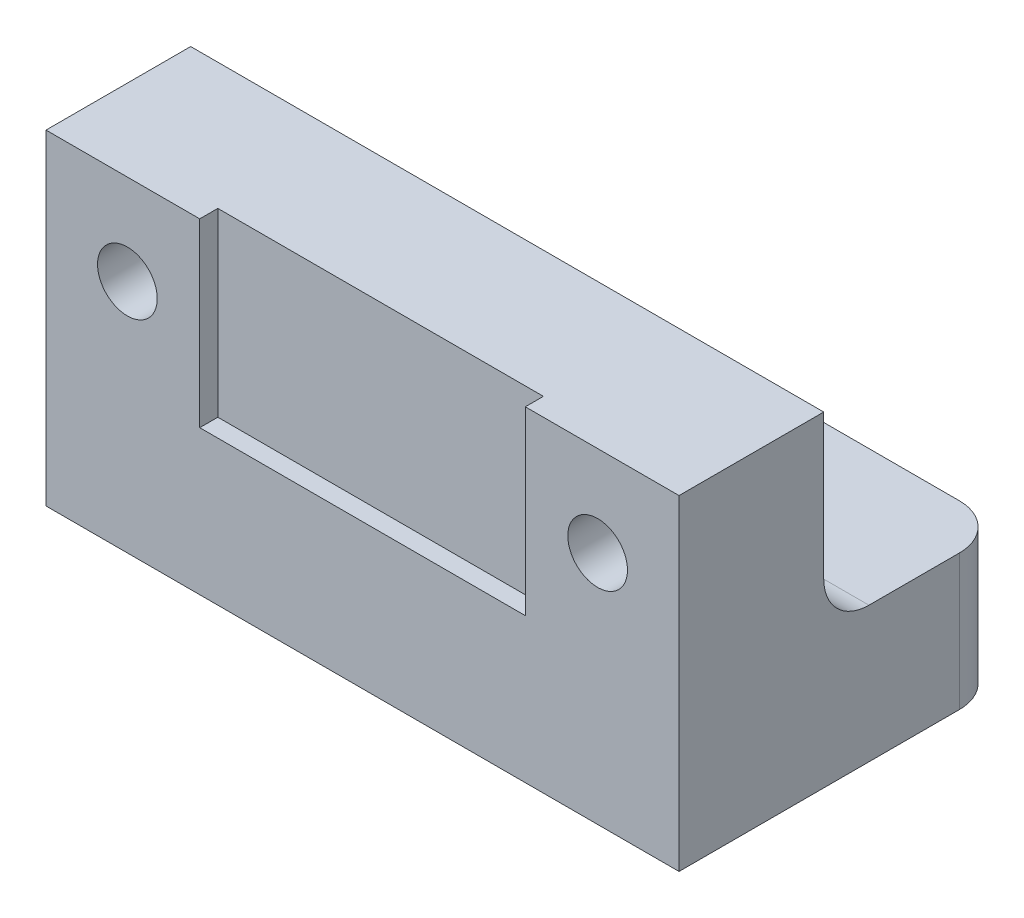
from build123d import *

# Parameters (mm, degrees)
SKETCH1_W           = 35
SKETCH1_H           = 18
BOSS_EXTRUDE1_DEPTH = 8
SKETCH4_W           = 18
SKETCH4_H           = 10
CUT_EXTRUDE3_DEPTH  = 1
CUT_EXTRUDE2_REACH  = 23.243
SKETCH3_R           = 1.65
SKETCH5_R           = 3
CUT_EXTRUDE4_DEPTH  = 4
SKETCH6_W           = 35
SKETCH6_H           = 7.5
BOSS_EXTRUDE2_DEPTH = 10
SKETCH7_R           = 8
CUT_EXTRUDE5_DEPTH  = 4.8
FILLET1_R           = 2.5


with BuildPart() as part:
    # Sketch1 → Boss-Extrude1 (new body)
    with BuildSketch(Plane.XY):
        Rectangle(SKETCH1_W, SKETCH1_H)
    extrude(amount=BOSS_EXTRUDE1_DEPTH)

    # Sketch4 → Cut-Extrude3 (cut)
    with BuildSketch(Plane.XY.offset(8)):
        with Locations((0, 4)):
            Rectangle(SKETCH4_W, SKETCH4_H)
    extrude(amount=-CUT_EXTRUDE3_DEPTH, mode=Mode.SUBTRACT)

    # Sketch3 → Cut-Extrude2 (cut, up to next)
    with BuildSketch(Plane(origin=(0, 0, 0), x_dir=(-1, 0, 0), z_dir=(0, 0, -1)), mode=Mode.PRIVATE) as cut_extrude2_sk1:
        with Locations((-13, 4)):
            Circle(SKETCH3_R)
    cut_extrude2_tool1 = extrude(cut_extrude2_sk1.sketch, amount=-CUT_EXTRUDE2_REACH, mode=Mode.PRIVATE) & part.part
    # Sketch3 → Cut-Extrude2 (cut, up to next)
    with BuildSketch(Plane(origin=(0, 0, 0), x_dir=(-1, 0, 0), z_dir=(0, 0, -1)), mode=Mode.PRIVATE) as cut_extrude2_sk2:
        with Locations((13, 4)):
            Circle(SKETCH3_R)
    cut_extrude2_tool2 = extrude(cut_extrude2_sk2.sketch, amount=-CUT_EXTRUDE2_REACH, mode=Mode.PRIVATE) & part.part
    add(cut_extrude2_tool1.solids().sort_by_distance((13, 4, 0))[0], mode=Mode.SUBTRACT)
    add(cut_extrude2_tool2.solids().sort_by_distance((-13, 4, 0))[0], mode=Mode.SUBTRACT)

    # Sketch5 → Cut-Extrude4 (cut)
    with BuildSketch(Plane(origin=(0, 0, 0), x_dir=(-1, 0, 0), z_dir=(0, 0, -1))):
        with Locations((-13, 4)):
            Circle(SKETCH5_R)
        with Locations((13, 4)):
            Circle(SKETCH5_R)
    extrude(amount=-CUT_EXTRUDE4_DEPTH, mode=Mode.SUBTRACT)

    # Sketch6 → Boss-Extrude2 (add)
    with BuildSketch(Plane.XY):
        with Locations((0, -5.25)):
            Rectangle(SKETCH6_W, SKETCH6_H)
    extrude(amount=-BOSS_EXTRUDE2_DEPTH)

    # Sketch7 → Cut-Extrude5 (cut)
    with BuildSketch(Plane(origin=(0, -9, 0), x_dir=(-1, 0, 0), z_dir=(0, -1, 0))):
        with Locations(Location((0, 1, 0), (0, 0, 90))):
            Circle(SKETCH7_R)
    extrude(amount=-CUT_EXTRUDE5_DEPTH, mode=Mode.SUBTRACT)

    # Fillet1
    fillet1_edges = [part.edges().sort_by_distance(p)[0] for p in [
        (17.5, -5.25, -10),
        (-17.5, -5.25, -10),
        (0, -1.5, 0),
    ]]
    fillet(fillet1_edges, radius=FILLET1_R - 0.0001)  # a hair under: the kernel refuses the full size


solid = part.part
